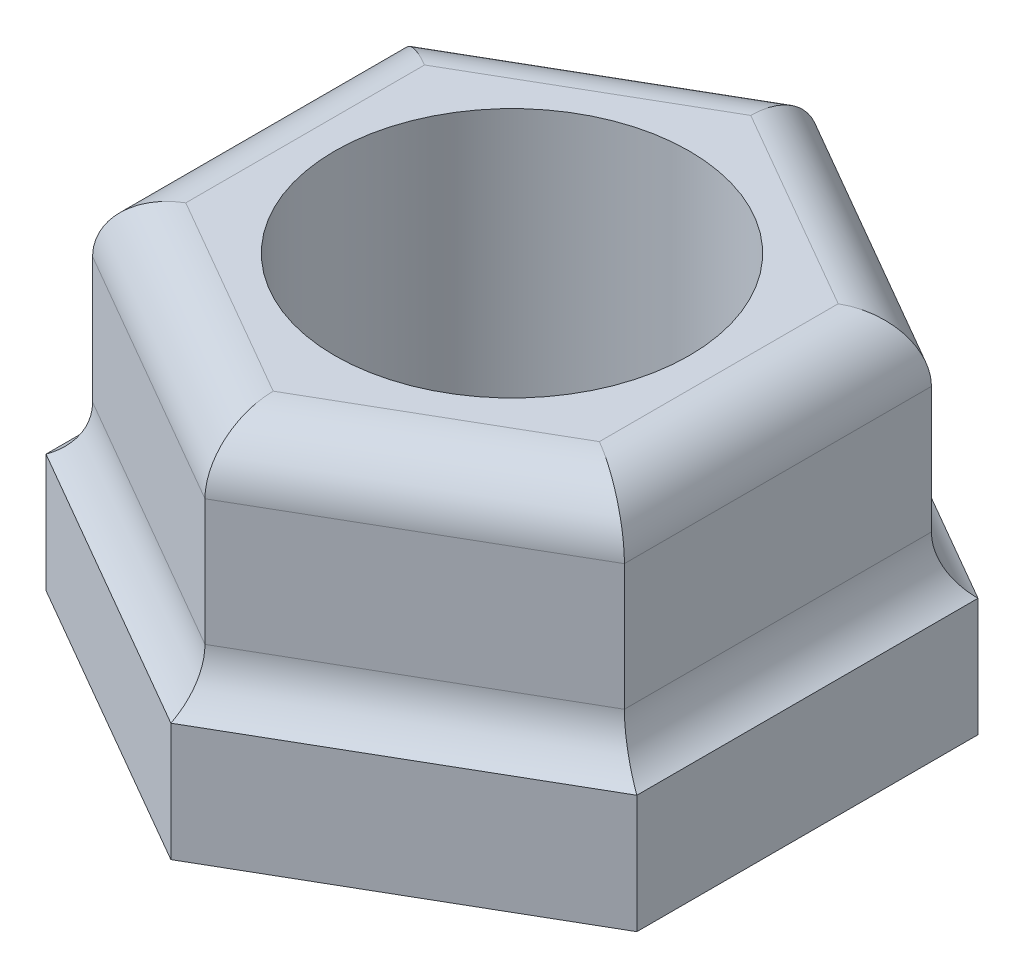
from build123d import *

# Parameters (mm, degrees)
SKETCH1_R           = 1.5
BOSS_EXTRUDE1_DEPTH = 3
SKETCH2_R           = 3.632993492
CUT_EXTRUDE1_DEPTH  = 2
FILLET1_R           = 0.5


with BuildPart() as part:
    # Sketch1 → Boss-Extrude1 (new body)
    with BuildSketch(Plane(origin=(0, 0, 0), x_dir=(1, 0, 0), z_dir=(0, 1, 0))):
        Polygon((0, -2.886751346), (2.5, -1.443375673), (2.5, 1.443375673), (0, 2.886751346), (-2.5, 1.443375673), (-2.5, -1.443375673), align=None)
        with Locations(Location((0, 0, 0), (0, 0, 270))):
            Circle(SKETCH1_R, mode=Mode.SUBTRACT)
    extrude(amount=BOSS_EXTRUDE1_DEPTH)

    # Sketch2 → Cut-Extrude1 (cut)
    with BuildSketch(Plane(origin=(0, 3, 0), x_dir=(1, 0, 0), z_dir=(0, 1, 0))):
        Circle(SKETCH2_R)
        Polygon((2.25, 1.299038106), (0, 2.598076211), (-2.25, 1.299038106), (-2.25, -1.299038106), (0, -2.598076211), (2.25, -1.299038106), align=None, mode=Mode.SUBTRACT)
    extrude(amount=-CUT_EXTRUDE1_DEPTH, mode=Mode.SUBTRACT)

    # Fillet1
    # the kernel refuses this fillet: 0.5 mm, written as the material it adds along each edge
    with BuildSketch(Plane(origin=(-0.9375, 1, 3.139342089), x_dir=(0.5000000000000002, 7.10542735760069e-14, 0.8660254037844385), z_dir=(0.8660254037844386, 0, -0.5000000000000002))) as fillet1_piece_1_section:
        with BuildLine():
            CenterArc((0.5, -0.433012702), FILLET1_R, 120, 60)
            Line((0, -0.433012702), (0, 0))
            Line((0, 0), (0.25, 0))
        make_face()
    fillet1_piece_1 = extrude(amount=4.763139721, mode=Mode.PRIVATE)
    fillet1_piece_1 = split(fillet1_piece_1, bisect_by=Plane(origin=(2.25, 1, 3.139342089), z_dir=(-1, 0, 0)), keep=Keep.TOP, mode=Mode.PRIVATE)
    fillet1_piece_1 = split(fillet1_piece_1, bisect_by=Plane(origin=(-0.46875, 1, 2.327443273), z_dir=(0.4999999999999999, 0, -0.8660254037844387)), keep=Keep.TOP, mode=Mode.PRIVATE)
    add(fillet1_piece_1)
    with BuildSketch(Plane(origin=(2.25, 1, 2.38156986), x_dir=(1, 0, 0), z_dir=(0, 0, -1))) as fillet1_piece_2_section:
        with BuildLine():
            CenterArc((0.5, -0.433012702), FILLET1_R, 120, 60)
            Line((0, -0.433012702), (0, 0))
            Line((0, 0), (0.25, 0))
        make_face()
    fillet1_piece_2 = extrude(amount=4.763139721, mode=Mode.PRIVATE)
    fillet1_piece_2 = split(fillet1_piece_2, bisect_by=Plane(origin=(1.78125, 1, 1.569671044), z_dir=(-0.5000000000000002, 0, -0.8660254037844386)), keep=Keep.TOP, mode=Mode.PRIVATE)
    fillet1_piece_2 = split(fillet1_piece_2, bisect_by=Plane(origin=(3.84375, 1, -0.378886114), z_dir=(-0.49999999999999956, 0, 0.8660254037844389)), keep=Keep.TOP, mode=Mode.PRIVATE)
    add(fillet1_piece_2)
    with BuildSketch(Plane(origin=(3.1875, 1, -0.757772228), x_dir=(0.49999999999999956, 7.194245199570714e-14, -0.8660254037844388), z_dir=(-0.8660254037844389, 0, -0.49999999999999956))) as fillet1_piece_3_section:
        with BuildLine():
            CenterArc((0.5, -0.433012702), FILLET1_R, 120, 60)
            Line((0, -0.433012702), (0, 0))
            Line((0, 0), (0.25, 0))
        make_face()
    fillet1_piece_3 = extrude(amount=4.763139721, mode=Mode.PRIVATE)
    fillet1_piece_3 = split(fillet1_piece_3, bisect_by=Plane(origin=(2.25, 1, -0.757772228), z_dir=(-1, 0, 0)), keep=Keep.TOP, mode=Mode.PRIVATE)
    fillet1_piece_3 = split(fillet1_piece_3, bisect_by=Plane(origin=(1.59375, 1, -3.518228203), z_dir=(0.5000000000000002, 0, 0.8660254037844385)), keep=Keep.TOP, mode=Mode.PRIVATE)
    add(fillet1_piece_3)
    with BuildSketch(Plane(origin=(0.9375, 1, -3.139342089), x_dir=(-0.5000000000000003, 7.283063041540705e-14, -0.8660254037844386), z_dir=(-0.8660254037844386, 0, 0.5000000000000003))) as fillet1_piece_4_section:
        with BuildLine():
            CenterArc((0.5, -0.433012702), FILLET1_R, 120, 60)
            Line((0, -0.433012702), (0, 0))
            Line((0, 0), (0.25, 0))
        make_face()
    fillet1_piece_4 = extrude(amount=4.763139721, mode=Mode.PRIVATE)
    fillet1_piece_4 = split(fillet1_piece_4, bisect_by=Plane(origin=(0.46875, 1, -2.327443273), z_dir=(-0.49999999999999956, 0, 0.8660254037844389)), keep=Keep.TOP, mode=Mode.PRIVATE)
    fillet1_piece_4 = split(fillet1_piece_4, bisect_by=Plane(origin=(-2.25, 1, -3.139342089), z_dir=(1, 0, 0)), keep=Keep.TOP, mode=Mode.PRIVATE)
    add(fillet1_piece_4)
    with BuildSketch(Plane(origin=(-2.25, 1, -2.38156986), x_dir=(-1, 0, 0), z_dir=(0, 0, 1))) as fillet1_piece_5_section:
        with BuildLine():
            CenterArc((0.5, -0.433012702), FILLET1_R, 120, 60)
            Line((0, -0.433012702), (0, 0))
            Line((0, 0), (0.25, 0))
        make_face()
    fillet1_piece_5 = extrude(amount=4.763139721, mode=Mode.PRIVATE)
    fillet1_piece_5 = split(fillet1_piece_5, bisect_by=Plane(origin=(-3.84375, 1, 0.378886114), z_dir=(0.4999999999999999, 0, -0.8660254037844387)), keep=Keep.TOP, mode=Mode.PRIVATE)
    fillet1_piece_5 = split(fillet1_piece_5, bisect_by=Plane(origin=(-1.78125, 1, -1.569671044), z_dir=(0.5000000000000002, 0, 0.8660254037844385)), keep=Keep.TOP, mode=Mode.PRIVATE)
    add(fillet1_piece_5)
    with BuildSketch(Plane(origin=(-3.1875, 1, 0.757772228), x_dir=(-0.4999999999999999, 7.194245199570713e-14, 0.8660254037844387), z_dir=(0.8660254037844387, 0, 0.4999999999999999))) as fillet1_piece_6_section:
        with BuildLine():
            CenterArc((0.5, -0.433012702), FILLET1_R, 120, 60)
            Line((0, -0.433012702), (0, 0))
            Line((0, 0), (0.25, 0))
        make_face()
    fillet1_piece_6 = extrude(amount=4.763139721, mode=Mode.PRIVATE)
    fillet1_piece_6 = split(fillet1_piece_6, bisect_by=Plane(origin=(-1.59375, 1, 3.518228203), z_dir=(-0.5000000000000002, 0, -0.8660254037844386)), keep=Keep.TOP, mode=Mode.PRIVATE)
    fillet1_piece_6 = split(fillet1_piece_6, bisect_by=Plane(origin=(-2.25, 1, 0.757772228), z_dir=(1, 0, 0)), keep=Keep.TOP, mode=Mode.PRIVATE)
    add(fillet1_piece_6)
    with BuildSketch(Plane(origin=(-0.9375, 1, 3.139342089), x_dir=(0.5000000000000002, 7.10542735760069e-14, 0.8660254037844385), z_dir=(0.8660254037844386, 0, -0.5000000000000002))) as fillet1_piece_7a_section:
        with BuildLine():
            CenterArc((0.5, -0.433012702), FILLET1_R, 120, 60)
            Line((0, -0.433012702), (0, 0))
            Line((0, 0), (0.25, 0))
        make_face()
    fillet1_piece_7a = extrude(amount=4.763139721, mode=Mode.PRIVATE)
    fillet1_piece_7a = split(fillet1_piece_7a, bisect_by=Plane(origin=(-0.59375, 1, 2.543949624), z_dir=(0.49999999999999983, 0, -0.8660254037844387)), keep=Keep.TOP, mode=Mode.PRIVATE)
    fillet1_piece_7a = split(fillet1_piece_7a, bisect_by=Plane(origin=(-0.46875, 1, 2.327443273), z_dir=(-0.4999999999999999, 0, 0.8660254037844387)), keep=Keep.TOP, mode=Mode.PRIVATE)
    with BuildSketch(Plane(origin=(-3.1875, 1, 0.757772228), x_dir=(-0.4999999999999999, 7.194245199570713e-14, 0.8660254037844387), z_dir=(0.8660254037844387, 0, 0.4999999999999999))) as fillet1_piece_7b_section:
        with BuildLine():
            CenterArc((0.5, -0.433012702), FILLET1_R, 120, 60)
            Line((0, -0.433012702), (0, 0))
            Line((0, 0), (0.25, 0))
        make_face()
    fillet1_piece_7b = extrude(amount=4.763139721, mode=Mode.PRIVATE)
    fillet1_piece_7b = split(fillet1_piece_7b, bisect_by=Plane(origin=(-1.46875, 1, 3.734734554), z_dir=(-0.5000000000000001, 0, -0.8660254037844387)), keep=Keep.TOP, mode=Mode.PRIVATE)
    fillet1_piece_7b = split(fillet1_piece_7b, bisect_by=Plane(origin=(-1.59375, 1, 3.518228203), z_dir=(0.5000000000000002, 0, 0.8660254037844386)), keep=Keep.TOP, mode=Mode.PRIVATE)
    fillet1_piece_7 = fillet1_piece_7a & fillet1_piece_7b
    add(fillet1_piece_7)
    with BuildSketch(Plane(origin=(2.25, 1, 2.38156986), x_dir=(1, 0, 0), z_dir=(0, 0, -1))) as fillet1_piece_8a_section:
        with BuildLine():
            CenterArc((0.5, -0.433012702), FILLET1_R, 120, 60)
            Line((0, -0.433012702), (0, 0))
            Line((0, 0), (0.25, 0))
        make_face()
    fillet1_piece_8a = extrude(amount=4.763139721, mode=Mode.PRIVATE)
    fillet1_piece_8a = split(fillet1_piece_8a, bisect_by=Plane(origin=(1.90625, 1, 1.786177395), z_dir=(-0.5000000000000001, 0, -0.8660254037844387)), keep=Keep.TOP, mode=Mode.PRIVATE)
    fillet1_piece_8a = split(fillet1_piece_8a, bisect_by=Plane(origin=(1.78125, 1, 1.569671044), z_dir=(0.5000000000000002, 0, 0.8660254037844386)), keep=Keep.TOP, mode=Mode.PRIVATE)
    with BuildSketch(Plane(origin=(-0.9375, 1, 3.139342089), x_dir=(0.5000000000000002, 7.10542735760069e-14, 0.8660254037844385), z_dir=(0.8660254037844386, 0, -0.5000000000000002))) as fillet1_piece_8b_section:
        with BuildLine():
            CenterArc((0.5, -0.433012702), FILLET1_R, 120, 60)
            Line((0, -0.433012702), (0, 0))
            Line((0, 0), (0.25, 0))
        make_face()
    fillet1_piece_8b = extrude(amount=4.763139721, mode=Mode.PRIVATE)
    fillet1_piece_8b = split(fillet1_piece_8b, bisect_by=Plane(origin=(2.5, 1, 3.139342089), z_dir=(-1, 0, 0)), keep=Keep.TOP, mode=Mode.PRIVATE)
    fillet1_piece_8b = split(fillet1_piece_8b, bisect_by=Plane(origin=(2.25, 1, 3.139342089), z_dir=(1, 0, 0)), keep=Keep.TOP, mode=Mode.PRIVATE)
    fillet1_piece_8 = fillet1_piece_8a & fillet1_piece_8b
    add(fillet1_piece_8)
    with BuildSketch(Plane(origin=(2.25, 1, 2.38156986), x_dir=(1, 0, 0), z_dir=(0, 0, -1))) as fillet1_piece_9a_section:
        with BuildLine():
            CenterArc((0.5, -0.433012702), FILLET1_R, 120, 60)
            Line((0, -0.433012702), (0, 0))
            Line((0, 0), (0.25, 0))
        make_face()
    fillet1_piece_9a = extrude(amount=4.763139721, mode=Mode.PRIVATE)
    fillet1_piece_9a = split(fillet1_piece_9a, bisect_by=Plane(origin=(3.96875, 1, -0.595392465), z_dir=(-0.49999999999999967, 0, 0.8660254037844388)), keep=Keep.TOP, mode=Mode.PRIVATE)
    fillet1_piece_9a = split(fillet1_piece_9a, bisect_by=Plane(origin=(3.84375, 1, -0.378886114), z_dir=(0.49999999999999956, 0, -0.8660254037844389)), keep=Keep.TOP, mode=Mode.PRIVATE)
    with BuildSketch(Plane(origin=(3.1875, 1, -0.757772228), x_dir=(0.49999999999999956, 7.194245199570714e-14, -0.8660254037844388), z_dir=(-0.8660254037844389, 0, -0.49999999999999956))) as fillet1_piece_9b_section:
        with BuildLine():
            CenterArc((0.5, -0.433012702), FILLET1_R, 120, 60)
            Line((0, -0.433012702), (0, 0))
            Line((0, 0), (0.25, 0))
        make_face()
    fillet1_piece_9b = extrude(amount=4.763139721, mode=Mode.PRIVATE)
    fillet1_piece_9b = split(fillet1_piece_9b, bisect_by=Plane(origin=(2.5, 1, -0.757772228), z_dir=(-1, 0, 0)), keep=Keep.TOP, mode=Mode.PRIVATE)
    fillet1_piece_9b = split(fillet1_piece_9b, bisect_by=Plane(origin=(2.25, 1, -0.757772228), z_dir=(1, 0, 0)), keep=Keep.TOP, mode=Mode.PRIVATE)
    fillet1_piece_9 = fillet1_piece_9a & fillet1_piece_9b
    add(fillet1_piece_9)
    with BuildSketch(Plane(origin=(3.1875, 1, -0.757772228), x_dir=(0.49999999999999956, 7.194245199570714e-14, -0.8660254037844388), z_dir=(-0.8660254037844389, 0, -0.49999999999999956))) as fillet1_piece_10a_section:
        with BuildLine():
            CenterArc((0.5, -0.433012702), FILLET1_R, 120, 60)
            Line((0, -0.433012702), (0, 0))
            Line((0, 0), (0.25, 0))
        make_face()
    fillet1_piece_10a = extrude(amount=4.763139721, mode=Mode.PRIVATE)
    fillet1_piece_10a = split(fillet1_piece_10a, bisect_by=Plane(origin=(1.46875, 1, -3.734734554), z_dir=(0.5000000000000002, 0, 0.8660254037844386)), keep=Keep.TOP, mode=Mode.PRIVATE)
    fillet1_piece_10a = split(fillet1_piece_10a, bisect_by=Plane(origin=(1.59375, 1, -3.518228203), z_dir=(-0.5000000000000002, 0, -0.8660254037844385)), keep=Keep.TOP, mode=Mode.PRIVATE)
    with BuildSketch(Plane(origin=(0.9375, 1, -3.139342089), x_dir=(-0.5000000000000003, 7.283063041540705e-14, -0.8660254037844386), z_dir=(-0.8660254037844386, 0, 0.5000000000000003))) as fillet1_piece_10b_section:
        with BuildLine():
            CenterArc((0.5, -0.433012702), FILLET1_R, 120, 60)
            Line((0, -0.433012702), (0, 0))
            Line((0, 0), (0.25, 0))
        make_face()
    fillet1_piece_10b = extrude(amount=4.763139721, mode=Mode.PRIVATE)
    fillet1_piece_10b = split(fillet1_piece_10b, bisect_by=Plane(origin=(0.59375, 1, -2.543949624), z_dir=(-0.49999999999999967, 0, 0.8660254037844388)), keep=Keep.TOP, mode=Mode.PRIVATE)
    fillet1_piece_10b = split(fillet1_piece_10b, bisect_by=Plane(origin=(0.46875, 1, -2.327443273), z_dir=(0.49999999999999956, 0, -0.8660254037844389)), keep=Keep.TOP, mode=Mode.PRIVATE)
    fillet1_piece_10 = fillet1_piece_10a & fillet1_piece_10b
    add(fillet1_piece_10)
    with BuildSketch(Plane(origin=(0.9375, 1, -3.139342089), x_dir=(-0.5000000000000003, 7.283063041540705e-14, -0.8660254037844386), z_dir=(-0.8660254037844386, 0, 0.5000000000000003))) as fillet1_piece_11a_section:
        with BuildLine():
            CenterArc((0.5, -0.433012702), FILLET1_R, 120, 60)
            Line((0, -0.433012702), (0, 0))
            Line((0, 0), (0.25, 0))
        make_face()
    fillet1_piece_11a = extrude(amount=4.763139721, mode=Mode.PRIVATE)
    fillet1_piece_11a = split(fillet1_piece_11a, bisect_by=Plane(origin=(-2.5, 1, -3.139342089), z_dir=(1, 0, 0)), keep=Keep.TOP, mode=Mode.PRIVATE)
    fillet1_piece_11a = split(fillet1_piece_11a, bisect_by=Plane(origin=(-2.25, 1, -3.139342089), z_dir=(-1, 0, 0)), keep=Keep.TOP, mode=Mode.PRIVATE)
    with BuildSketch(Plane(origin=(-2.25, 1, -2.38156986), x_dir=(-1, 0, 0), z_dir=(0, 0, 1))) as fillet1_piece_11b_section:
        with BuildLine():
            CenterArc((0.5, -0.433012702), FILLET1_R, 120, 60)
            Line((0, -0.433012702), (0, 0))
            Line((0, 0), (0.25, 0))
        make_face()
    fillet1_piece_11b = extrude(amount=4.763139721, mode=Mode.PRIVATE)
    fillet1_piece_11b = split(fillet1_piece_11b, bisect_by=Plane(origin=(-1.90625, 1, -1.786177395), z_dir=(0.5000000000000002, 0, 0.8660254037844386)), keep=Keep.TOP, mode=Mode.PRIVATE)
    fillet1_piece_11b = split(fillet1_piece_11b, bisect_by=Plane(origin=(-1.78125, 1, -1.569671044), z_dir=(-0.5000000000000002, 0, -0.8660254037844385)), keep=Keep.TOP, mode=Mode.PRIVATE)
    fillet1_piece_11 = fillet1_piece_11a & fillet1_piece_11b
    add(fillet1_piece_11)
    with BuildSketch(Plane(origin=(-3.1875, 1, 0.757772228), x_dir=(-0.4999999999999999, 7.194245199570713e-14, 0.8660254037844387), z_dir=(0.8660254037844387, 0, 0.4999999999999999))) as fillet1_piece_12a_section:
        with BuildLine():
            CenterArc((0.5, -0.433012702), FILLET1_R, 120, 60)
            Line((0, -0.433012702), (0, 0))
            Line((0, 0), (0.25, 0))
        make_face()
    fillet1_piece_12a = extrude(amount=4.763139721, mode=Mode.PRIVATE)
    fillet1_piece_12a = split(fillet1_piece_12a, bisect_by=Plane(origin=(-2.5, 1, 0.757772228), z_dir=(1, 0, 0)), keep=Keep.TOP, mode=Mode.PRIVATE)
    fillet1_piece_12a = split(fillet1_piece_12a, bisect_by=Plane(origin=(-2.25, 1, 0.757772228), z_dir=(-1, 0, 0)), keep=Keep.TOP, mode=Mode.PRIVATE)
    with BuildSketch(Plane(origin=(-2.25, 1, -2.38156986), x_dir=(-1, 0, 0), z_dir=(0, 0, 1))) as fillet1_piece_12b_section:
        with BuildLine():
            CenterArc((0.5, -0.433012702), FILLET1_R, 120, 60)
            Line((0, -0.433012702), (0, 0))
            Line((0, 0), (0.25, 0))
        make_face()
    fillet1_piece_12b = extrude(amount=4.763139721, mode=Mode.PRIVATE)
    fillet1_piece_12b = split(fillet1_piece_12b, bisect_by=Plane(origin=(-3.96875, 1, 0.595392465), z_dir=(0.49999999999999983, 0, -0.8660254037844387)), keep=Keep.TOP, mode=Mode.PRIVATE)
    fillet1_piece_12b = split(fillet1_piece_12b, bisect_by=Plane(origin=(-3.84375, 1, 0.378886114), z_dir=(-0.4999999999999999, 0, 0.8660254037844387)), keep=Keep.TOP, mode=Mode.PRIVATE)
    fillet1_piece_12 = fillet1_piece_12a & fillet1_piece_12b
    add(fillet1_piece_12)
    # the kernel refuses this fillet: 0.5 mm, written as the material it takes off along each edge
    with BuildSketch(Plane(origin=(2.25, 3, 2.549038106), x_dir=(0, -1, 0), z_dir=(0, 0, -1)), Plane(origin=(-1.082531755, 3, 3.223076211), x_dir=(0, -1, 0), z_dir=(0.8660254037844386, 0, -0.5000000000000002)), Plane(origin=(-3.332531755, 3, 0.674038106), x_dir=(0, -1, 0), z_dir=(0.8660254037844387, 0, 0.4999999999999999)), Plane(origin=(-2.25, 3, -2.549038106), x_dir=(0, -1, 0), z_dir=(0, 0, 1)), Plane(origin=(1.082531755, 3, -3.223076211), x_dir=(0, -1, 0), z_dir=(-0.8660254037844386, 0, 0.5000000000000003)), Plane(origin=(3.332531755, 3, -0.674038106), x_dir=(0, -1, 0), z_dir=(-0.8660254037844389, 0, -0.49999999999999956))) as fillet1_2_piece_1:
        with BuildLine():
            CenterArc((FILLET1_R, FILLET1_R), FILLET1_R, 180, 90)
            Line((0, FILLET1_R), (0, 0))
            Line((0, 0), (FILLET1_R, 0))
        make_face()
    extrude(amount=5.098076211, mode=Mode.SUBTRACT)


solid = part.part
